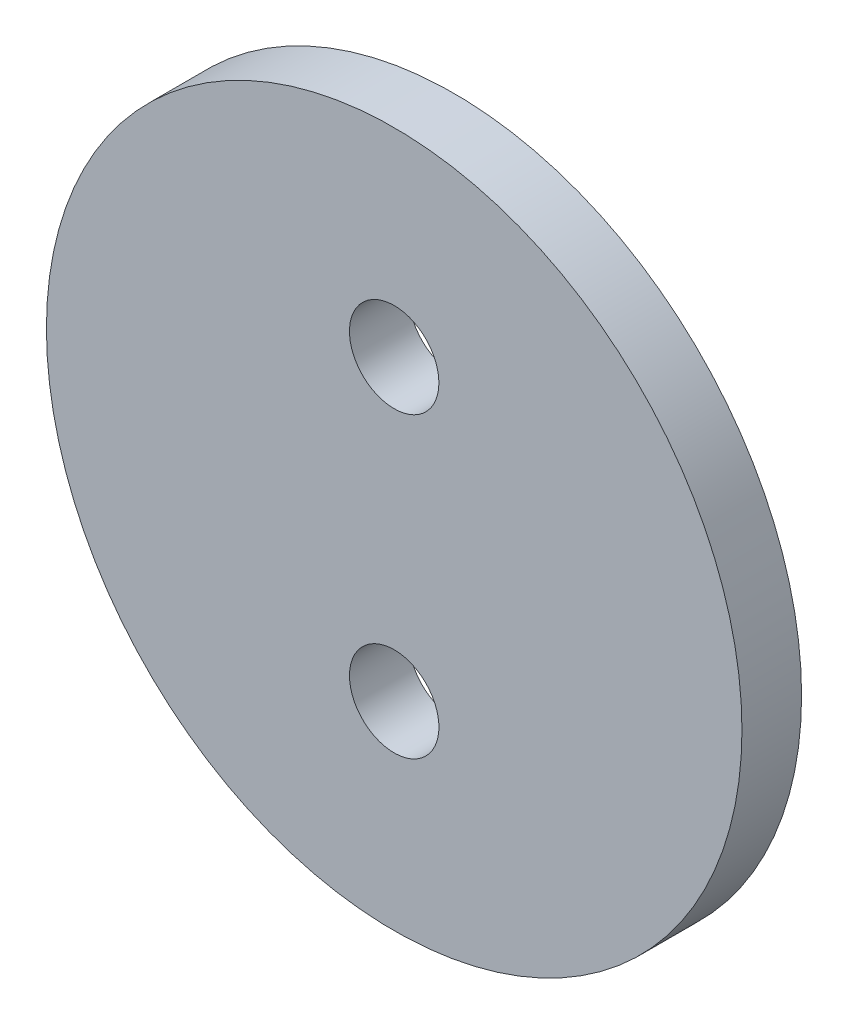
from build123d import *

# Parameters (mm, degrees)
SKETCH_1_R          = 7
EXTRUDE_1_DEPTH     = 1.2
SKETCH_2_R          = 0.9
CUT_EXTRUDE_1_DEPTH = 10.97196069


with BuildPart() as part:
    # 草图1 → 凸台-拉伸1 (new body)
    with BuildSketch(Plane.XY):
        Circle(SKETCH_1_R)
    extrude(amount=EXTRUDE_1_DEPTH)

    # 草图2 → 切除-拉伸1 (cut, through all)
    with BuildSketch(Plane.XY.offset(1.2)):
        with Locations((0, 3)):
            Circle(SKETCH_2_R)
        with Locations((0, -3)):
            Circle(SKETCH_2_R)
    extrude(amount=-CUT_EXTRUDE_1_DEPTH, mode=Mode.SUBTRACT)


solid = part.part
